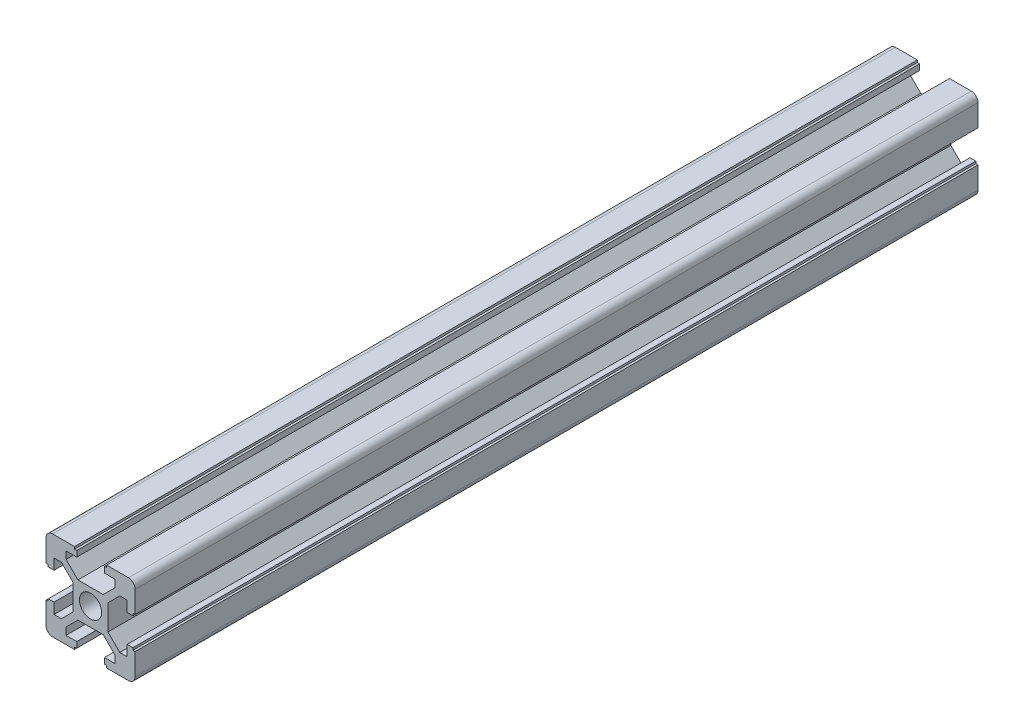
from build123d import *

# Parameters (mm, degrees)
SKETCH1_R           = 2.5
BOSS_EXTRUDE1_DEPTH = 189.096108091
SCALE_2_SCALE       = 3
SCALE_3_SCALE       = 6
SCALE_5_SCALE       = 2
SCALE_6_SCALE       = 0.25
SCALE_7_SCALE       = 0.125
SCALE_8_SCALE       = 0.25
SCALE_9_SCALE       = 4
SCALE_10_SCALE      = 4
OTHER_START         = 7.55
OTHER_1_OUTLINE_R   = 5
OTHER_1_DEPTH       = 10
SCALE_11_SCALE      = 0.111111111


# Read off the part's stored shape, not the designer's step: 孔1
with BuildPart() as part:
    # Sketch1 → Boss-Extrude1 (new body)
    with BuildSketch(Plane.XY):
        with BuildLine():
            Line((2.839339828, 3.9), (5.5, 6.560660172))
            Line((5.5, 6.560660172), (5.5, 8.2))
            Line((5.5, 8.2), (3.1, 8.2))
            Line((3.1, 8.2), (3.1, 9.5))
            Line((3.1, 9.5), (3.6, 9.5))
            Line((3.6, 9.5), (3.6, 10))
            Line((3.6, 10), (8.5, 10))
            ThreePointArc((8.5, 10), (9.560660172, 9.560660172), (10, 8.5))
            Line((10, 8.5), (10, 3.6))
            Line((10, 3.6), (9.5, 3.6))
            Line((9.5, 3.6), (9.5, 3.1))
            Line((9.5, 3.1), (8.2, 3.1))
            Line((8.2, 3.1), (8.2, 5.5))
            Line((8.2, 5.5), (6.560660172, 5.5))
            Line((6.560660172, 5.5), (3.9, 2.839339828))
            Line((3.9, 2.839339828), (3.9, -2.839339828))
            Line((3.9, -2.839339828), (6.560660172, -5.5))
            Line((6.560660172, -5.5), (8.2, -5.5))
            Line((8.2, -5.5), (8.2, -3.1))
            Line((8.2, -3.1), (9.5, -3.1))
            Line((9.5, -3.1), (9.5, -3.6))
            Line((9.5, -3.6), (10, -3.6))
            Line((10, -3.6), (10, -8.5))
            ThreePointArc((10, -8.5), (9.560660172, -9.560660172), (8.5, -10))
            Line((8.5, -10), (3.6, -10))
            Line((3.6, -10), (3.6, -9.5))
            Line((3.6, -9.5), (3.1, -9.5))
            Line((3.1, -9.5), (3.1, -8.2))
            Line((3.1, -8.2), (5.5, -8.2))
            Line((5.5, -8.2), (5.5, -6.560660172))
            Line((5.5, -6.560660172), (2.839339828, -3.9))
            Line((2.839339828, -3.9), (-2.839339828, -3.9))
            Line((-2.839339828, -3.9), (-5.5, -6.560660172))
            Line((-5.5, -6.560660172), (-5.5, -8.2))
            Line((-5.5, -8.2), (-3.1, -8.2))
            Line((-3.1, -8.2), (-3.1, -9.5))
            Line((-3.1, -9.5), (-3.6, -9.5))
            Line((-3.6, -9.5), (-3.6, -10))
            Line((-3.6, -10), (-8.5, -10))
            ThreePointArc((-8.5, -10), (-9.560660172, -9.560660172), (-10, -8.5))
            Line((-10, -8.5), (-10, -3.6))
            Line((-10, -3.6), (-9.5, -3.6))
            Line((-9.5, -3.6), (-9.5, -3.1))
            Line((-9.5, -3.1), (-8.2, -3.1))
            Line((-8.2, -3.1), (-8.2, -5.5))
            Line((-8.2, -5.5), (-6.560660172, -5.5))
            Line((-6.560660172, -5.5), (-3.9, -2.839339828))
            Line((-3.9, -2.839339828), (-3.9, 2.839339828))
            Line((-3.9, 2.839339828), (-6.560660172, 5.5))
            Line((-6.560660172, 5.5), (-8.2, 5.5))
            Line((-8.2, 5.5), (-8.2, 3.1))
            Line((-8.2, 3.1), (-9.5, 3.1))
            Line((-9.5, 3.1), (-9.5, 3.6))
            Line((-9.5, 3.6), (-10, 3.6))
            Line((-10, 3.6), (-10, 8.5))
            ThreePointArc((-10, 8.5), (-9.560660172, 9.560660172), (-8.5, 10))
            Line((-8.5, 10), (-3.6, 10))
            Line((-3.6, 10), (-3.6, 9.5))
            Line((-3.6, 9.5), (-3.1, 9.5))
            Line((-3.1, 9.5), (-3.1, 8.2))
            Line((-3.1, 8.2), (-5.5, 8.2))
            Line((-5.5, 8.2), (-5.5, 6.560660172))
            Line((-5.5, 6.560660172), (-2.839339828, 3.9))
            Line((-2.839339828, 3.9), (2.839339828, 3.9))
        make_face()
        with Locations((0, 0.235847297)):
            Circle(SKETCH1_R, mode=Mode.SUBTRACT)
    extrude(amount=BOSS_EXTRUDE1_DEPTH)


with BuildPart() as part_1:
    # 缩放比例2: scaled about (0, -0.027095247, 94.548054046)
    add(part.part.scale(SCALE_2_SCALE).moved(Location((0, 0.054190494, -189.096108092))))


with BuildPart() as part_2:
    # 缩放比例3: scaled about (0, -0.027095247, 94.548054045)
    add(part_1.part.scale(SCALE_3_SCALE).moved(Location((0, 0.135476235, -472.740270225))))


with BuildPart() as part_3:
    # 缩放比例5: scaled about (0, -0.027095249, 94.548054043)
    add(part_2.part.scale(SCALE_5_SCALE).moved(Location((0, 0.027095249, -94.548054043))))


with BuildPart() as part_4:
    # 缩放比例6: scaled about (0, -0.027095249, 94.548054044)
    add(part_3.part.scale(SCALE_6_SCALE).moved(Location((0, -0.020321437, 70.911040533))))


with BuildPart() as part_5:
    # 缩放比例7: scaled about (0, -0.027095249, 94.548054044)
    add(part_4.part.scale(SCALE_7_SCALE).moved(Location((0, -0.023708343, 82.729547289))))


with BuildPart() as part_6:
    # 缩放比例8: scaled about (0, -0.027095249, 94.548054044)
    add(part_5.part.scale(SCALE_8_SCALE).moved(Location((0, -0.020321437, 70.911040533))))


with BuildPart() as part_7:
    # 缩放比例9: scaled about (0, -0.027095249, 94.548054044)
    add(part_6.part.scale(SCALE_9_SCALE).moved(Location((0, 0.081285747, -283.644162132))))


with BuildPart() as part_8:
    # 缩放比例10: scaled about (0, -0.027095249, 94.548054044)
    add(part_7.part.scale(SCALE_10_SCALE).moved(Location((0, 0.081285747, -283.644162132))))

    # 孔1 outline → 孔1 (cut)
    with BuildSketch(Plane.YZ.offset(OTHER_START)):
        with Locations((7.344832291, -26.42806198)):
            Circle(OTHER_1_OUTLINE_R)
    extrude(amount=OTHER_1_DEPTH, mode=Mode.SUBTRACT)


with BuildPart() as part_9:
    # 缩放比例11: scaled about (-0.002946752, -0.028813034, 94.574865823)
    add(part_8.part.scale(SCALE_11_SCALE).moved(Location((-0.002619335, -0.025611586, 84.066547398))))


solid = part_9.part
